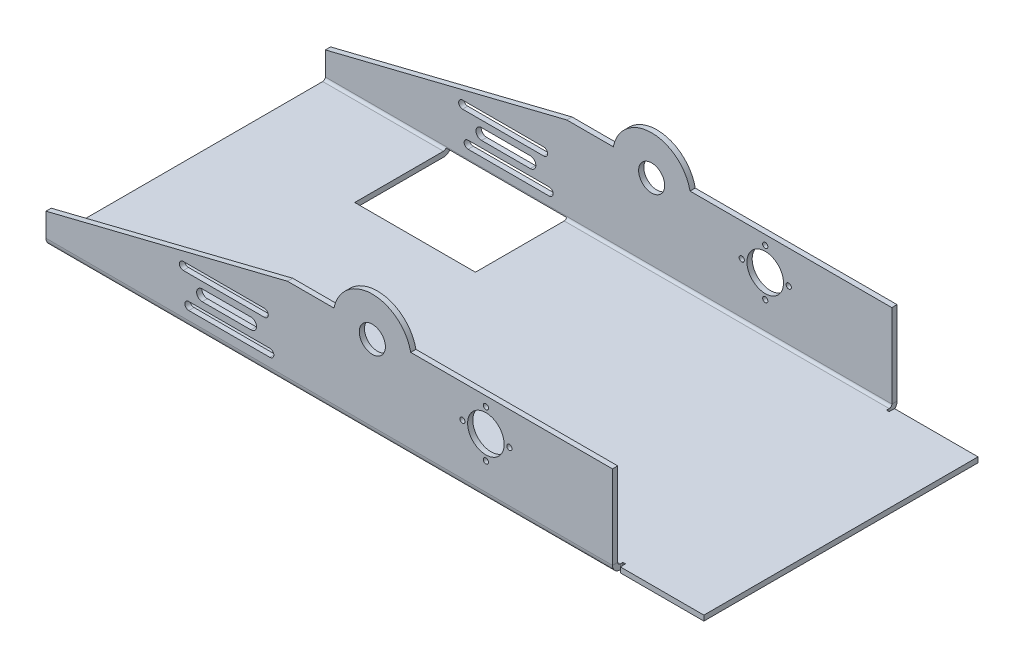
from build123d import *

# Parameters (mm, degrees)
SKETCH3_W                       = 250
SKETCH3_H                       = 105
BASE_FLANGE1_DEPTH              = 2
EDGE_FLANGE1_STRIP_W            = 10
EDGE_FLANGE1_STRIP_H            = 2
EDGE_FLANGE1_STRIP_CUT_DEPTH    = 217
EDGE_FLANGE1_RELIEF_W           = 11
EDGE_FLANGE1_RELIEF_H           = 1
EDGE_FLANGE1_RELIEF_CUT_DEPTH   = 2
EDGE_FLANGE1_STRIP_2_W          = 10
EDGE_FLANGE1_STRIP_2_H          = 2
EDGE_FLANGE1_STRIP_CUT_2_DEPTH  = 217
EDGE_FLANGE1_RELIEF_2_W         = 11
EDGE_FLANGE1_RELIEF_2_H         = 1
EDGE_FLANGE1_RELIEF_CUT_2_DEPTH = 2
EDGE_FLANGE1_DEPTH              = 217
EDGE_FLANGE1_START              = 2
EDGE_FLANGE1_PROFILE_R          = 5
EDGE_FLANGE1_FLAT_DEPTH         = 2
EDGE_FLANGE1_BEND_DEPTH         = 217
EDGE_FLANGE1_PROFILE_2_R        = 5
EDGE_FLANGE1_FLAT_2_DEPTH       = 2
CUT_EXTRUDE2_START              = -78.75
CUT_EXTRUDE2_DEPTH              = 46.25
CUT_EXTRUDE1_DEPTH              = 144.597527834
CUT_EXTRUDE1_DEPTH_BACK         = 144.597527834
SKETCH14_R                      = 1
SKETCH14_R_2                    = 7


# Read off the part's stored shape, not the designer's step: Cut-Extrude2
# Sheet-metal steps are written as plain solids
with BuildPart() as part:
    # Sketch3 → Base-Flange1 (new body)
    with BuildSketch(Plane(origin=(0, 0, 0), x_dir=(1, 0, 0), z_dir=(0, 1, 0))):
        Rectangle(SKETCH3_W, SKETCH3_H)
    extrude(amount=-BASE_FLANGE1_DEPTH)

    # Edge-Flange1 strip (across the edge) → Edge-Flange1 strip cut (cut)
    with BuildSketch(Plane(origin=(-125, 0, 52.5), x_dir=(0, 0, -1), z_dir=(1, 0, 0))):
        with Locations((-4, -1)):
            Rectangle(EDGE_FLANGE1_STRIP_W, EDGE_FLANGE1_STRIP_H)
    extrude(amount=EDGE_FLANGE1_STRIP_CUT_DEPTH, mode=Mode.SUBTRACT)

    # Edge-Flange1 relief (on the sheet) → Edge-Flange1 relief cut (cut)
    with BuildSketch(Plane(origin=(-125, 0, 51.5), x_dir=(0, 0, -1), z_dir=(0, 1, 0))):
        with Locations((-4.5, -217.5)):
            Rectangle(EDGE_FLANGE1_RELIEF_W, EDGE_FLANGE1_RELIEF_H)
    extrude(amount=-EDGE_FLANGE1_RELIEF_CUT_DEPTH, mode=Mode.SUBTRACT)

    # Edge-Flange1 strip 2 (across the edge) → Edge-Flange1 strip cut 2 (cut)
    with BuildSketch(Plane(origin=(92, 0, -52.5), x_dir=(0, 0, 1), z_dir=(-1, 0, 0))):
        with Locations((-4, -1)):
            Rectangle(EDGE_FLANGE1_STRIP_2_W, EDGE_FLANGE1_STRIP_2_H)
    extrude(amount=EDGE_FLANGE1_STRIP_CUT_2_DEPTH, mode=Mode.SUBTRACT)

    # Edge-Flange1 relief 2 (on the sheet) → Edge-Flange1 relief cut 2 (cut)
    with BuildSketch(Plane(origin=(92, 0, -51.5), x_dir=(0, 0, 1), z_dir=(0, 1, 0))):
        with Locations((-4.5, 0.5)):
            Rectangle(EDGE_FLANGE1_RELIEF_2_W, EDGE_FLANGE1_RELIEF_2_H)
    extrude(amount=-EDGE_FLANGE1_RELIEF_CUT_2_DEPTH, mode=Mode.SUBTRACT)

    # Edge-Flange1 bend section (across the edge) → Edge-Flange1 (add)
    with BuildSketch(Plane(origin=(-125, 0, 52.5), x_dir=(0, 0, -1), z_dir=(1, 0, 0))):
        with BuildLine():
            Line((-2, 1), (0, 1))
            ThreePointArc((0, 1), (0.292893219, 0.292893219), (1, 0))
            Line((1, 0), (1, -2))
            ThreePointArc((1, -2), (-1.121320344, -1.121320344), (-2, 1))
        make_face()
    extrude(amount=EDGE_FLANGE1_DEPTH)

    # Edge-Flange1 profile (on flange) → Edge-Flange1 flat (add)
    with BuildSketch(Plane.XY.offset(52.5).offset(EDGE_FLANGE1_START)):
        with BuildLine():
            Line((-125, 9.993471807), (-125, 1))
            Line((-125, 1), (92, 1))
            Line((92, 1), (92, 33))
            Line((92, 33), (14.696938457, 33))
            ThreePointArc((14.696938457, 33), (0, 45), (-14.696938457, 33))
            Line((-14.696938457, 33), (-32.5, 33))
            Line((-32.5, 33), (-125, 9.993471807))
        make_face()
        with Locations((0, 30)):
            Circle(EDGE_FLANGE1_PROFILE_R, mode=Mode.SUBTRACT)
    extrude(amount=-EDGE_FLANGE1_FLAT_DEPTH)

    # Edge-Flange1 bend section 2 (across the edge) → Edge-Flange1 bend (add)
    with BuildSketch(Plane(origin=(92, 0, -52.5), x_dir=(0, 0, 1), z_dir=(-1, 0, 0))):
        with BuildLine():
            Line((-2, 1), (0, 1))
            ThreePointArc((0, 1), (0.292893219, 0.292893219), (1, 0))
            Line((1, 0), (1, -2))
            ThreePointArc((1, -2), (-1.121320344, -1.121320344), (-2, 1))
        make_face()
    extrude(amount=EDGE_FLANGE1_BEND_DEPTH)

    # Edge-Flange1 profile 2 (on flange) → Edge-Flange1 flat 2 (add)
    with BuildSketch(Plane(origin=(0, 0, -52.5), x_dir=(-1, 0, 0), z_dir=(0, 0, -1)).offset(EDGE_FLANGE1_START)):
        with BuildLine():
            Line((-92, 33), (-92, 1))
            Line((-92, 1), (125, 1))
            Line((125, 1), (125, 9.993471807))
            Line((125, 9.993471807), (32.5, 33))
            Line((32.5, 33), (14.696938457, 33))
            ThreePointArc((14.696938457, 33), (0, 45), (-14.696938457, 33))
            Line((-14.696938457, 33), (-92, 33))
        make_face()
        with Locations((0, 30)):
            Circle(EDGE_FLANGE1_PROFILE_2_R, mode=Mode.SUBTRACT)
    extrude(amount=-EDGE_FLANGE1_FLAT_2_DEPTH)

    # Cut-Extrude2 outline → Cut-Extrude2 (cut)
    with BuildSketch(Plane.YZ.offset(CUT_EXTRUDE2_START)):
        with BuildLine():
            Line((0, -54.328427125), (0.666666667, -52.442809042))
            ThreePointArc((0.666666667, -52.442809042), (0.183503419, -52.077350269), (0, -51.5))
            Line((0, -51.5), (0, -17.5))
            Line((0, -17.5), (-2, -17.5))
            Line((-2, -17.5), (-2, -51.5))
            ThreePointArc((-2, -51.5), (-1.449489743, -53.232050808), (0, -54.328427125))
        make_face()
    extrude(amount=CUT_EXTRUDE2_DEPTH, mode=Mode.SUBTRACT)

    # Sketch14 → Cut-Extrude1 (cut, two sides: drawn at the far end of the back side and taken through both)
    with BuildSketch(Plane.XY.offset(-CUT_EXTRUDE1_DEPTH_BACK)):
        with BuildLine():
            Line((-46.5, 14.125), (-65.166666667, 14.125))
            ThreePointArc((-65.166666667, 14.125), (-67.291666667, 12), (-65.166666667, 9.875))
            Line((-65.166666667, 9.875), (-46.5, 9.875))
            ThreePointArc((-46.5, 9.875), (-44.375, 12), (-46.5, 14.125))
        make_face()
        with BuildLine():
            Line((-57.900010285, 4.380710415), (-51.653085966, 4.380710415))
            ThreePointArc((-51.653085966, 4.380710415), (-50.153085966, 5.880710415), (-51.653085966, 7.380710415))
            Line((-51.653085966, 7.380710415), (-57.900010285, 7.380710415))
            ThreePointArc((-57.900010285, 7.380710415), (-59.400010285, 5.880710415), (-57.900010285, 4.380710415))
        make_face()
        with BuildLine():
            Line((-51.653085966, 4.380710415), (-39.233343618, 4.380710415))
            ThreePointArc((-39.233343618, 4.380710415), (-37.733343618, 5.880710415), (-39.233343618, 7.380710415))
            Line((-39.233343618, 7.380710415), (-51.653085966, 7.380710415))
            ThreePointArc((-51.653085966, 7.380710415), (-50.153085966, 5.880710415), (-51.653085966, 4.380710415))
        make_face()
        with BuildLine():
            Line((-70.319752633, 4.380710415), (-57.900010285, 4.380710415))
            ThreePointArc((-57.900010285, 4.380710415), (-59.400010285, 5.880710415), (-57.900010285, 7.380710415))
            Line((-57.900010285, 7.380710415), (-70.319752633, 7.380710415))
            ThreePointArc((-70.319752633, 7.380710415), (-71.819752633, 5.880710415), (-70.319752633, 4.380710415))
        make_face()
        with BuildLine():
            Line((-72.433323049, 16.619289585), (-60.0135807, 16.619289585))
            ThreePointArc((-60.0135807, 16.619289585), (-61.5135807, 18.119289585), (-60.0135807, 19.619289585))
            Line((-60.0135807, 19.619289585), (-72.433323049, 19.619289585))
            ThreePointArc((-72.433323049, 19.619289585), (-73.933323049, 18.119289585), (-72.433323049, 16.619289585))
        make_face()
        with BuildLine():
            Line((-60.0135807, 16.619289585), (-53.766656382, 16.619289585))
            ThreePointArc((-53.766656382, 16.619289585), (-52.266656382, 18.119289585), (-53.766656382, 19.619289585))
            Line((-53.766656382, 19.619289585), (-60.0135807, 19.619289585))
            ThreePointArc((-60.0135807, 19.619289585), (-61.5135807, 18.119289585), (-60.0135807, 16.619289585))
        make_face()
        with BuildLine():
            ThreePointArc((-53.766656382, 19.619289585), (-52.266656382, 18.119289585), (-53.766656382, 16.619289585))
            Line((-53.766656382, 16.619289585), (-41.346914034, 16.619289585))
            ThreePointArc((-41.346914034, 16.619289585), (-39.846914034, 18.119289585), (-41.346914034, 19.619289585))
            Line((-41.346914034, 19.619289585), (-53.766656382, 19.619289585))
        make_face()
        with Locations((43.5, 11.4)):
            Circle(SKETCH14_R)
        with Locations((52.5, 20.4)):
            Circle(SKETCH14_R)
        with Locations((43.5, 20.4)):
            Circle(SKETCH14_R_2)
        with Locations((34.5, 20.4)):
            Circle(SKETCH14_R)
        with Locations((43.5, 29.4)):
            Circle(SKETCH14_R)
    extrude(amount=CUT_EXTRUDE1_DEPTH + CUT_EXTRUDE1_DEPTH_BACK, mode=Mode.SUBTRACT)


solid = part.part
